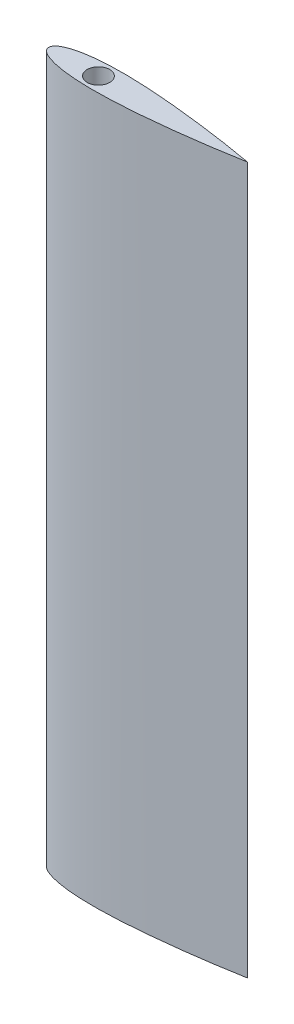
from build123d import *

# Parameters (mm, degrees)
SKETCH1_2_R        = 2.95
CUT_EXTRUDE2_DEPTH = 193.130237992


with BuildPart() as part:
    # rootSketch → Loft1 section 0
    with BuildSketch(Plane(origin=(0, 31.75, 0), x_dir=(1, 0, 0), z_dir=(0, 1, 0))):
        with BuildLine():
            add(Edge.make_bspline(
                [(0, 0), (-1.6572e-05, 0.056577364), (0.005364667, 0.148026672), (0.026073501, 0.280241396), (0.077769955, 0.452215412), (0.147060273, 0.611874915), (0.248525433, 0.785971359), (0.39236103, 0.977542518), (0.599181982, 1.195423819), (0.905829823, 1.451816919), (1.370469676, 1.757918922), (2.078266075, 2.119108524), (3.175731681, 2.542039428), (4.823252293, 2.99869744), (7.275411011, 3.452976612), (10.438659341, 3.780475746), (14.129329887, 3.929259057), (18.143568779, 3.896250983), (22.151742679, 3.722301475), (25.656241741, 3.475962342), (28.651461505, 3.213566971), (31.650711737, 2.914013348), (34.134157887, 2.639630917), (36.639458817, 2.336640809), (39.599525944, 1.953685828), (42.127939329, 1.60070159), (44.533194308, 1.24753169), (47.121130826, 0.837424538), (48.910319544, 0.545474341), (50.6553202, 0.241362714), (51.550989041, 0.081579679), (52, 0)],
                knots=[0, 0, 0, 0, 0, 0.003840944, 0.006235023, 0.009072291, 0.01219322, 0.015656839, 0.019917177, 0.025338962, 0.032592504, 0.042799388, 0.05770457, 0.079310668, 0.112503101, 0.158972616, 0.227236465, 0.295500326, 0.36376419, 0.432028053, 0.500291915, 0.534423847, 0.56855578, 0.636819643, 0.670951575, 0.705083508, 0.773347371, 0.807479302, 0.841611234, 0.875743167, 0.9098751, 0.9098751, 0.9098751, 0.9098751, 0.9098751], degree=4))
            add(Edge.make_bspline(
                [(0, 0), (-1.6572e-05, -0.056577364), (0.005364667, -0.148026672), (0.026073501, -0.280241396), (0.077769955, -0.452215412), (0.147060273, -0.611874915), (0.248525433, -0.785971359), (0.39236103, -0.977542518), (0.599181982, -1.195423819), (0.905829823, -1.451816919), (1.370469676, -1.757918922), (2.078266075, -2.119108524), (3.175731681, -2.542039428), (4.823252293, -2.99869744), (7.275411011, -3.452976612), (10.438659341, -3.780475746), (14.129329887, -3.929259057), (18.143568779, -3.896250983), (22.151742679, -3.722301475), (25.656241741, -3.475962342), (28.651461505, -3.213566971), (31.650711737, -2.914013348), (34.134157887, -2.639630917), (36.639458817, -2.336640809), (39.599525944, -1.953685828), (42.127939329, -1.60070159), (44.533194308, -1.24753169), (47.121130826, -0.837424538), (48.910319544, -0.545474341), (50.6553202, -0.241362714), (51.550989041, -0.081579679), (52, 0)],
                knots=[0, 0, 0, 0, 0, 0.003840944, 0.006235023, 0.009072291, 0.01219322, 0.015656839, 0.019917177, 0.025338962, 0.032592504, 0.042799388, 0.05770457, 0.079310668, 0.112503101, 0.158972616, 0.227236465, 0.295500326, 0.36376419, 0.432028053, 0.500291915, 0.534423847, 0.56855578, 0.636819643, 0.670951575, 0.705083508, 0.773347371, 0.807479302, 0.841611234, 0.875743167, 0.9098751, 0.9098751, 0.9098751, 0.9098751, 0.9098751], degree=4))
        make_face()
    # tipSketch → Loft1 section 1
    with BuildSketch(Plane(origin=(0, 216.6684, 0), x_dir=(1, 0, 0), z_dir=(0, 1, 0))):
        with BuildLine():
            add(Edge.make_bspline(
                [(0, 0), (-1.6572e-05, 0.056577364), (0.005364667, 0.148026672), (0.026073501, 0.280241396), (0.077769955, 0.452215412), (0.147060273, 0.611874915), (0.248525433, 0.785971359), (0.39236103, 0.977542518), (0.599181982, 1.195423819), (0.905829823, 1.451816919), (1.370469676, 1.757918922), (2.078266075, 2.119108524), (3.175731681, 2.542039428), (4.823252293, 2.99869744), (7.275411011, 3.452976612), (10.438659341, 3.780475746), (14.129329887, 3.929259057), (18.143568779, 3.896250983), (22.151742679, 3.722301475), (25.656241741, 3.475962342), (28.651461505, 3.213566971), (31.650711737, 2.914013348), (34.134157887, 2.639630917), (36.639458817, 2.336640809), (39.599525944, 1.953685828), (42.127939329, 1.60070159), (44.533194308, 1.24753169), (47.121130826, 0.837424538), (48.910319544, 0.545474341), (50.6553202, 0.241362714), (51.550989041, 0.081579679), (52, 0)],
                knots=[0, 0, 0, 0, 0, 0.003840944, 0.006235023, 0.009072291, 0.01219322, 0.015656839, 0.019917177, 0.025338962, 0.032592504, 0.042799388, 0.05770457, 0.079310668, 0.112503101, 0.158972616, 0.227236465, 0.295500326, 0.36376419, 0.432028053, 0.500291915, 0.534423847, 0.56855578, 0.636819643, 0.670951575, 0.705083508, 0.773347371, 0.807479302, 0.841611234, 0.875743167, 0.9098751, 0.9098751, 0.9098751, 0.9098751, 0.9098751], degree=4))
            add(Edge.make_bspline(
                [(0, 0), (-1.6572e-05, -0.056577364), (0.005364667, -0.148026672), (0.026073501, -0.280241396), (0.077769955, -0.452215412), (0.147060273, -0.611874915), (0.248525433, -0.785971359), (0.39236103, -0.977542518), (0.599181982, -1.195423819), (0.905829823, -1.451816919), (1.370469676, -1.757918922), (2.078266075, -2.119108524), (3.175731681, -2.542039428), (4.823252293, -2.99869744), (7.275411011, -3.452976612), (10.438659341, -3.780475746), (14.129329887, -3.929259057), (18.143568779, -3.896250983), (22.151742679, -3.722301475), (25.656241741, -3.475962342), (28.651461505, -3.213566971), (31.650711737, -2.914013348), (34.134157887, -2.639630917), (36.639458817, -2.336640809), (39.599525944, -1.953685828), (42.127939329, -1.60070159), (44.533194308, -1.24753169), (47.121130826, -0.837424538), (48.910319544, -0.545474341), (50.6553202, -0.241362714), (51.550989041, -0.081579679), (52, 0)],
                knots=[0, 0, 0, 0, 0, 0.003840944, 0.006235023, 0.009072291, 0.01219322, 0.015656839, 0.019917177, 0.025338962, 0.032592504, 0.042799388, 0.05770457, 0.079310668, 0.112503101, 0.158972616, 0.227236465, 0.295500326, 0.36376419, 0.432028053, 0.500291915, 0.534423847, 0.56855578, 0.636819643, 0.670951575, 0.705083508, 0.773347371, 0.807479302, 0.841611234, 0.875743167, 0.9098751, 0.9098751, 0.9098751, 0.9098751, 0.9098751], degree=4))
        make_face()
    loft()

    # Sketch1<2> → Cut-Extrude2 (cut, through all)
    with BuildSketch(Plane(origin=(0, 31.75, 0), x_dir=(1, 0, 0), z_dir=(0, 1, 0))):
        with Locations((12.999969404, 0)):
            Circle(SKETCH1_2_R)
    extrude(amount=CUT_EXTRUDE2_DEPTH, mode=Mode.SUBTRACT)


solid = part.part
